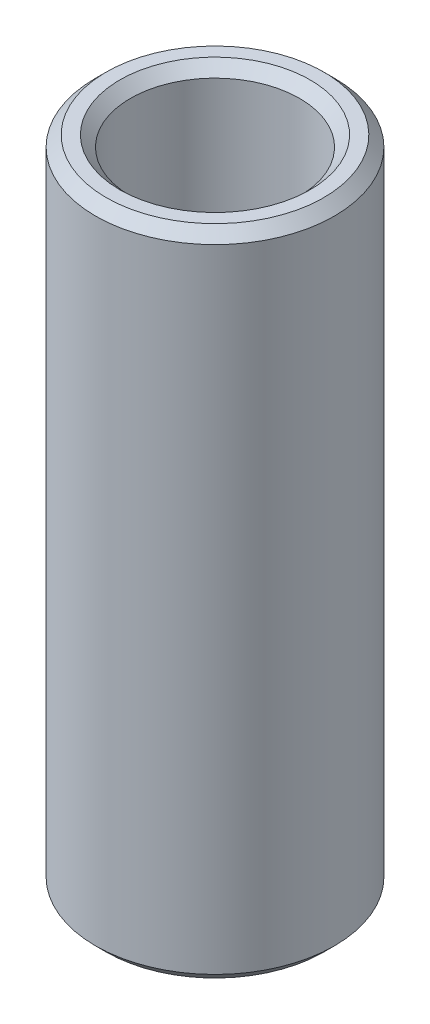
from build123d import *

# Parameters (mm, degrees)
SKETCH1_R           = 15
BOSS_EXTRUDE1_DEPTH = 82.04560737
SKETCH2_R           = 10.618051434
CUT_EXTRUDE1_DEPTH  = 85.743623293
CHAMFER1_SIZE       = 1.337094075


with BuildPart() as part:
    # Sketch1 → Boss-Extrude1 (new body)
    with BuildSketch(Plane(origin=(0, 0, 0), x_dir=(1, 0, 0), z_dir=(0, 1, 0))):
        Circle(SKETCH1_R)
    extrude(amount=BOSS_EXTRUDE1_DEPTH)

    # Sketch2 → Cut-Extrude1 (cut, through all)
    with BuildSketch(Plane(origin=(0, 0, 0), x_dir=(1, 0, 0), z_dir=(0, 1, 0))):
        Circle(SKETCH2_R)
    extrude(amount=CUT_EXTRUDE1_DEPTH, mode=Mode.SUBTRACT)

    # Chamfer1
    chamfer1_edges = [part.edges().sort_by_distance(p)[0] for p in [
        (-10.618051434, 82.04560737, 0),
        (-10.618051434, 0, 0),
        (-15, 0, 0),
        (-15, 82.04560737, 0),
    ]]
    chamfer(chamfer1_edges, length=CHAMFER1_SIZE)


solid = part.part
